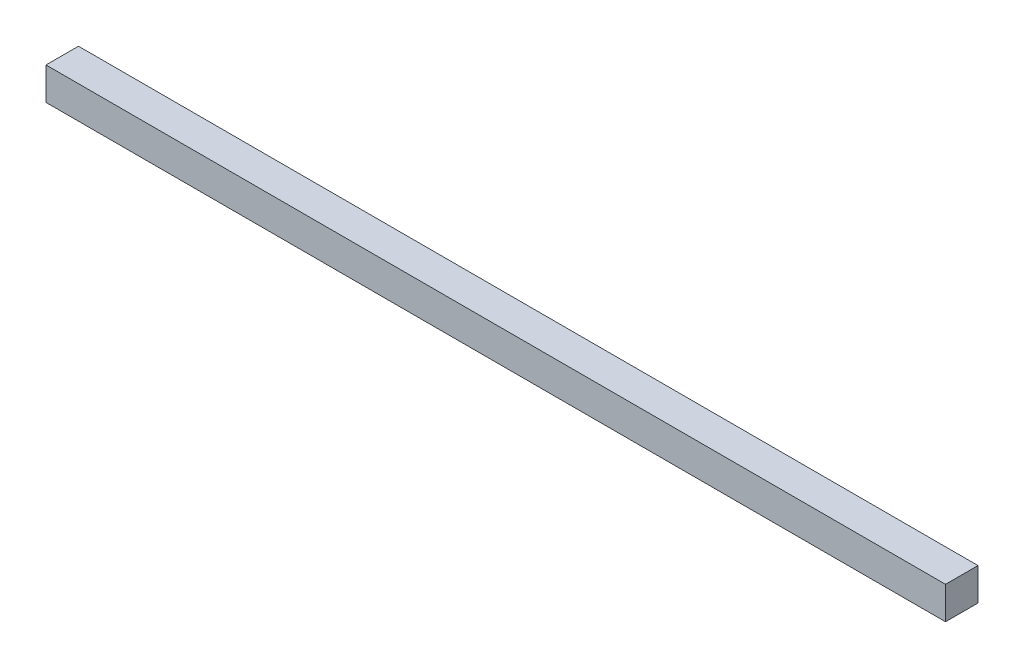
from build123d import *

# Parameters (mm, degrees)
ESQUISSE1_W        = 277
ESQUISSE1_H        = 10
BOSS_EXTRU_1_DEPTH = 10


with BuildPart() as part:
    # Esquisse1 → Boss.-Extru.1 (new body)
    with BuildSketch(Plane.XY):
        with Locations((22.276774786, 34.186046512)):
            Rectangle(ESQUISSE1_W, ESQUISSE1_H)
    extrude(amount=BOSS_EXTRU_1_DEPTH)


solid = part.part
